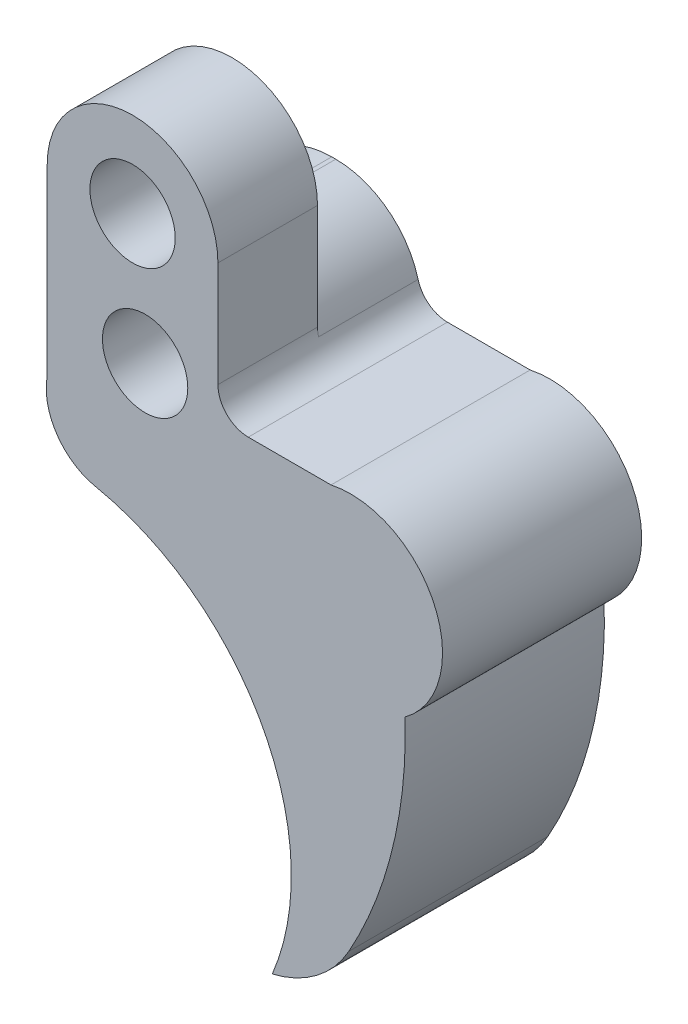
from build123d import *

# Parameters (mm, degrees)
BOSS_EXTRUDE1_DEPTH      = 3.5
BOSS_EXTRUDE1_DEPTH_BACK = 3.5
SKETCH6_R                = 1.5
CUT_EXTRUDE1_DEPTH       = 19.96660999
SKETCH7_W                = 4.034122634
SKETCH7_H                = 6.882168449
CUT_EXTRUDE2_DEPTH       = 18.97170817
FILLET1_R                = 3
CUT_EXTRUDE3_DEPTH       = 18.97170817
CUT_EXTRUDE3_DEPTH_BACK  = 18.97170817
SKETCH5_R                = 1.5


with BuildPart() as part:
    # Sketch1 → Boss-Extrude1 (new, two sides: drawn at the far end of the back side and taken through both)
    with BuildSketch(Plane.XY.offset(-BOSS_EXTRUDE1_DEPTH_BACK)):
        with BuildLine():
            Line((-7.379331989, 6.554089817), (-7.379331989, 12.992324067))
            ThreePointArc((-7.379331989, 12.992324067), (-4.379331989, 15.992324067), (-1.379331989, 12.992324067))
            Line((-1.379331989, 12.992324067), (-1.379331989, 9.288226288))
            ThreePointArc((-1.379331989, 9.288226288), (-1.067058002, 8.534330194), (-0.313161909, 8.222056208))
            Line((-0.313161909, 8.222056208), (2.596292865, 8.222056208))
            ThreePointArc((2.596292865, 8.222056208), (6.230009224, 6.392230094), (5.19642183, 2.457277072))
            ThreePointArc((5.19642183, 2.457277072), (4.763363262, -1.740328915), (3.218784408, -5.667377669))
            ThreePointArc((3.218784408, -5.667377669), (2.087900651, -6.964096239), (0.531658525, -7.697913361))
            ThreePointArc((0.531658525, -7.697913361), (0.209560398, -0.37433078), (-5.652587934, 4.027240071))
            ThreePointArc((-5.652587934, 4.027240071), (-7.035324124, 4.93575307), (-7.379331989, 6.554089817))
        make_face()
    extrude(amount=BOSS_EXTRUDE1_DEPTH + BOSS_EXTRUDE1_DEPTH_BACK)

    # Sketch6 → Cut-Extrude1 (cut, through all)
    with BuildSketch(Plane.XY.offset(3.5)):
        with Locations((-4.379331989, 12.992324067)):
            Circle(SKETCH6_R)
    extrude(amount=-CUT_EXTRUDE1_DEPTH, mode=Mode.SUBTRACT)

    # Sketch7 → Cut-Extrude2 (cut, through all)
    with BuildSketch(Plane(origin=(0, 0, 0), x_dir=(0, 0, -1), z_dir=(1, 0, 0))):
        with Locations((2.017061317, 14.662562736)):
            Rectangle(SKETCH7_W, SKETCH7_H)
    extrude(amount=-CUT_EXTRUDE2_DEPTH, mode=Mode.SUBTRACT)

    # Fillet1
    # the kernel refuses this fillet: 3 mm, written as the material it takes off along each edge
    with BuildSketch(Plane(origin=(-7.379331989, 11.221478511, 0), x_dir=(0, -1, 0), z_dir=(0, 0, -1))) as fillet1_piece_1:
        with BuildLine():
            CenterArc((FILLET1_R, -FILLET1_R), FILLET1_R, 90, 90)
            Line((0, -FILLET1_R), (0, 0))
            Line((0, 0), (FILLET1_R, 0))
        make_face()
    extrude(amount=11, mode=Mode.SUBTRACT)
    with BuildSketch(Plane(origin=(-1.379331989, 11.221478511, -10.643941593), x_dir=(0.016872794888794368, -0.9998576442637425, 0), z_dir=(0, 0, 1))) as fillet1_piece_2:
        with BuildLine():
            CenterArc((2.951357628, -2.907788229), FILLET1_R, 104.242588424, 74.790625764)
            Line((-0.048215304, -2.857169845), (-0.348172598, -2.852108006))
            Line((-0.348172598, -2.852108006), (-0.299957293, 0.005061838))
            Line((-0.299957293, 0.005061838), (0.005061838, 0.299957293))
            ThreePointArc((0.005061838, 0.299957293), (1.938038852, 0.267337925), (2.13946551, 0.290778823))
            Line((2.13946551, 0.290778823), (2.213273884, 0))
        make_face()
    extrude(amount=10.643941593, mode=Mode.SUBTRACT)

    # Sketch5 → Cut-Extrude3 (cut, two sides: drawn at the far end of the back side and taken through both)
    with BuildSketch(Plane.XY.offset(-CUT_EXTRUDE3_DEPTH_BACK)):
        with Locations((-3.938565523, 8.651692055)):
            Circle(SKETCH5_R)
    extrude(amount=CUT_EXTRUDE3_DEPTH + CUT_EXTRUDE3_DEPTH_BACK, mode=Mode.SUBTRACT)


solid = part.part
